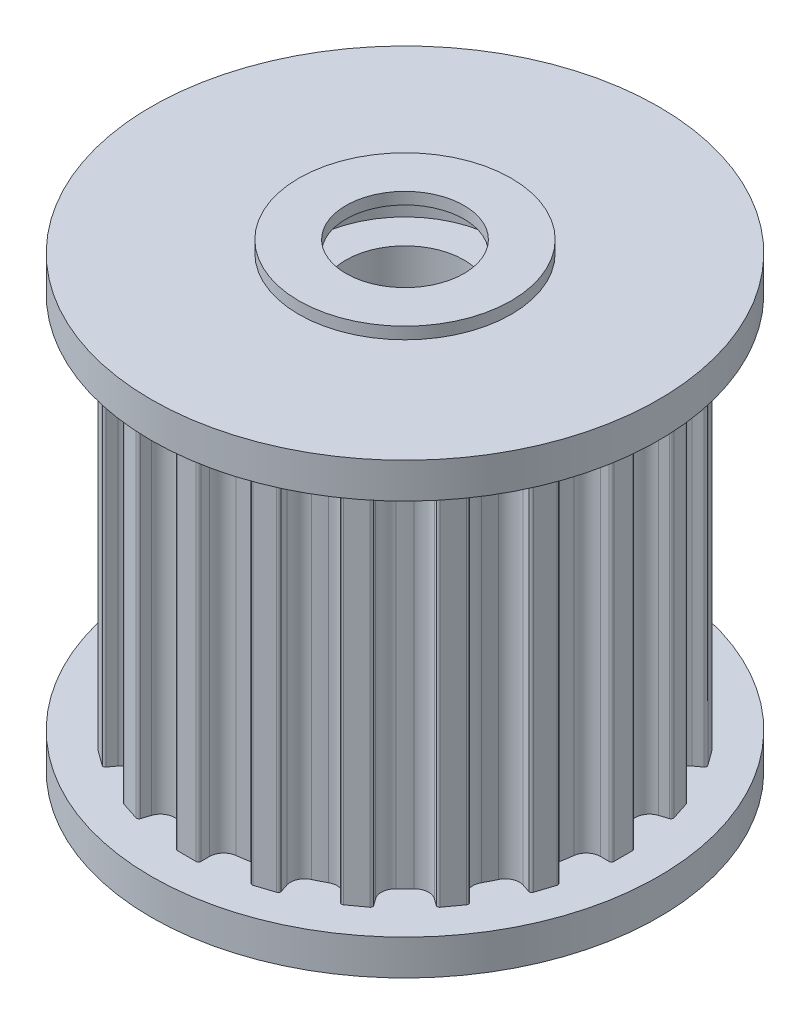
from build123d import *
from build123d.topology import SkipClean

# Parameters (mm, degrees)
SKETCH_1_R                       = 8.25
SKETCH_1_R_2                     = 2.5
EXTRUDE_1_DEPTH                  = 16
SKETCH_2_W                       = 1
SKETCH_2_H                       = 2
EXTRUDE_2_DEPTH                  = 16
FILLET_1_R                       = 0.6
FILLET_2_R                       = 0.1
PATTERN_CIRCULAR_2_COUNT         = 20
FILLET_1_OF_PATTERN_CIRCULAR_2_R = 0.6
FILLET_2_OF_PATTERN_CIRCULAR_2_R = 0.1
EXTRUDE_START                    = 1.5
SKETCH_3_R                       = 10.75
SKETCH_3_R_2                     = 2.5
EXTRUDE_1_2_DEPTH                = 1.5
SKETCH_4_R                       = 10.75
SKETCH_4_R_2                     = 4
EXTRUDE_2_2_DEPTH                = 1.5
EXTRUDE_START_2                  = 0.5
SKETCH_5_R                       = 4.5
SKETCH_5_R_2                     = 2.5
EXTRUDE_3_DEPTH                  = 0.5
SKETCH_6_R                       = 4.5
SKETCH_6_R_2                     = 2.5
EXTRUDE_4_DEPTH                  = 0.5
SKETCH_9_R                       = 1.5
CUT_EXTRUDE_2_DEPTH              = 24.561090807
EXTRUDE_START_3                  = -4
SKETCH_11_R                      = 1.5
EXTRUDE_4_2_DEPTH                = 4
CUT_EXTRUDE_3_DEPTH              = 2
PATTERN_CIRCULAR_3_COUNT         = 2
PATTERN_CIRCULAR_3_ANGLE         = 90
SKETCH_13_R                      = 1.5
EXTRUDE_5_DEPTH                  = 4
CUT_EXTRUDE_4_DEPTH              = 2


with BuildPart() as part:
    # Эскиз1 → Extrude 1 (new body)
    with BuildSketch(Plane(origin=(0, 0, 0), x_dir=(1, 0, 0), z_dir=(0, 1, 0))):
        with Locations(Location((0, 0, 0), (0, 0, 270))):
            Circle(SKETCH_1_R)
        with Locations(Location((0, 0, 0), (0, 0, 270))):
            Circle(SKETCH_1_R_2, mode=Mode.SUBTRACT)
    extrude(amount=EXTRUDE_1_DEPTH)

    # Эскиз2 → Extrude 2 (add)
    with BuildSketch(Plane(origin=(0, 16, 0), x_dir=(1, 0, 0), z_dir=(0, 1, 0))):
        with Locations((0, 8.25)):
            Rectangle(SKETCH_2_W, SKETCH_2_H)
    extrude_2 = extrude(amount=-EXTRUDE_2_DEPTH)

    # Скругление1
    fillet_1_edges = [part.edges().sort_by_distance(p)[0] for p in [
        (-0.5, 8, -8.234834546),
        (0.5, 8, -8.234834546),
    ]]
    fillet(fillet_1_edges, radius=FILLET_1_R)

    # Скругление2
    fillet_2_edges = [part.edges().sort_by_distance(p)[0] for p in [
        (0.5, 8, -9.25),
        (-0.5, 8, -9.25),
    ]]
    fillet(fillet_2_edges, radius=FILLET_2_R)

    # Круговой массив2: Extrude 2 ×20 about axis
    pattern_circular_2_axis = Axis((0, 0, 0), (0, 1, 0))
    for i in range(1, PATTERN_CIRCULAR_2_COUNT):
        add(extrude_2.rotate(pattern_circular_2_axis, i * 360 / PATTERN_CIRCULAR_2_COUNT))

    # Скругление1 of Круговой массив2
    fillet_1_of_pattern_circular_2_edges = [part.edges().sort_by_distance(p)[0] for p in [
        (-3.020232079, 8, -7.677284558),
        (-2.069175562, 8, -7.986301553),
        (-5.244822798, 8, -6.368228467),
        (-4.435805804, 8, -6.95601372),
        (-6.95601372, 8, -4.435805804),
        (-6.368228467, 8, -5.244822798),
        (-7.986301553, 8, -2.069175562),
        (-7.677284558, 8, -3.020232079),
        (-8.234834546, 8, 0.5),
        (-8.234834546, 8, -0.5),
        (-7.677284558, 8, 3.020232079),
        (-7.986301553, 8, 2.069175562),
        (-6.368228467, 8, 5.244822798),
        (-6.95601372, 8, 4.435805804),
        (-4.435805804, 8, 6.95601372),
        (-5.244822798, 8, 6.368228467),
        (-2.069175562, 8, 7.986301553),
        (-3.020232079, 8, 7.677284558),
        (0.5, 8, 8.234834546),
        (-0.5, 8, 8.234834546),
        (3.020232079, 8, 7.677284558),
        (2.069175562, 8, 7.986301553),
        (5.244822798, 8, 6.368228467),
        (4.435805804, 8, 6.95601372),
        (6.95601372, 8, 4.435805804),
        (6.368228467, 8, 5.244822798),
        (7.986301553, 8, 2.069175562),
        (7.677284558, 8, 3.020232079),
        (8.234834546, 8, -0.5),
        (8.234834546, 8, 0.5),
        (7.677284558, 8, -3.020232079),
        (7.986301553, 8, -2.069175562),
        (6.368228467, 8, -5.244822798),
        (6.95601372, 8, -4.435805804),
        (4.435805804, 8, -6.95601372),
        (5.244822798, 8, -6.368228467),
        (2.069175562, 8, -7.986301553),
        (3.020232079, 8, -7.677284558),
    ]]
    fillet(fillet_1_of_pattern_circular_2_edges, radius=FILLET_1_OF_PATTERN_CIRCULAR_2_R)

    # Скругление2 of Круговой массив2
    fillet_2_of_pattern_circular_2_edges = [part.edges().sort_by_distance(p)[0] for p in [
        (-2.38287894, 8, -8.951781273),
        (-3.333935456, 8, -8.642764279),
        (-5.032505087, 8, -7.777299824),
        (-5.841522081, 8, -7.189514572),
        (-7.189514572, 8, -5.841522081),
        (-7.777299824, 8, -5.032505087),
        (-8.642764279, 8, -3.333935456),
        (-8.951781273, 8, -2.38287894),
        (-9.25, 8, -0.5),
        (-9.25, 8, 0.5),
        (-8.951781273, 8, 2.38287894),
        (-8.642764279, 8, 3.333935456),
        (-7.777299824, 8, 5.032505087),
        (-7.189514572, 8, 5.841522081),
        (-5.841522081, 8, 7.189514572),
        (-5.032505087, 8, 7.777299824),
        (-3.333935456, 8, 8.642764279),
        (-2.38287894, 8, 8.951781273),
        (-0.5, 8, 9.25),
        (0.5, 8, 9.25),
        (2.38287894, 8, 8.951781273),
        (3.333935456, 8, 8.642764279),
        (5.032505087, 8, 7.777299824),
        (5.841522081, 8, 7.189514572),
        (7.189514572, 8, 5.841522081),
        (7.777299824, 8, 5.032505087),
        (8.642764279, 8, 3.333935456),
        (8.951781273, 8, 2.38287894),
        (9.25, 8, 0.5),
        (9.25, 8, -0.5),
        (8.951781273, 8, -2.38287894),
        (8.642764279, 8, -3.333935456),
        (7.777299824, 8, -5.032505087),
        (7.189514572, 8, -5.841522081),
        (5.841522081, 8, -7.189514572),
        (5.032505087, 8, -7.777299824),
        (3.333935456, 8, -8.642764279),
        (2.38287894, 8, -8.951781273),
    ]]
    fillet(fillet_2_of_pattern_circular_2_edges, radius=FILLET_2_OF_PATTERN_CIRCULAR_2_R)

    # Эскиз3 → Extrude 1 2 (add)
    with SkipClean():  # the faces are left unmerged after this step: merging them gives an invalid solid
        with BuildSketch(Plane.XZ.offset(EXTRUDE_START)):
            Circle(SKETCH_3_R)
            Circle(SKETCH_3_R_2, mode=Mode.SUBTRACT)
        extrude(amount=-EXTRUDE_1_2_DEPTH)

    # Эскиз4 → Extrude 2 2 (add)
    with BuildSketch(Plane(origin=(0, 16, 0), x_dir=(1, 0, 0), z_dir=(0, 1, 0))):
        Circle(SKETCH_4_R)
        Circle(SKETCH_4_R_2, mode=Mode.SUBTRACT)
    extrude(amount=EXTRUDE_2_2_DEPTH)

    # Эскиз5 → Вытянуть-Тонкостенный3 (add)
    with BuildSketch(Plane.XZ.offset(1.5).offset(EXTRUDE_START_2)):
        Circle(SKETCH_5_R)
        Circle(SKETCH_5_R_2, mode=Mode.SUBTRACT)
    extrude(amount=-EXTRUDE_3_DEPTH)

    # Эскиз6 → Extrude 4 (add)
    with BuildSketch(Plane(origin=(0, 17.5, 0), x_dir=(1, 0, 0), z_dir=(0, 1, 0))):
        Circle(SKETCH_6_R)
        Circle(SKETCH_6_R_2, mode=Mode.SUBTRACT)
    extrude(amount=EXTRUDE_4_DEPTH)

    # Эскиз9 → Вырез-Вытянуть2 (cut, through all)
    with BuildSketch(Plane(origin=(0, 0, 0), x_dir=(0, -1, 0), z_dir=(0.9510565162951534, 0, 0.3090169943749482))):
        with Locations(Location((-8, -1.289904334, 0), (0, 0, 143.610629276))):
            Circle(SKETCH_9_R)
    cut_extrude_2 = extrude(amount=-CUT_EXTRUDE_2_DEPTH, mode=Mode.SUBTRACT)

    # Круговой массив3: Вырез-Вытянуть2 ×2 about axis
    pattern_circular_3_axis = Axis((0, 0, 0), (0, -1, 0))
    for i in range(1, PATTERN_CIRCULAR_3_COUNT):
        add(cut_extrude_2.rotate(pattern_circular_3_axis, i * PATTERN_CIRCULAR_3_ANGLE / (PATTERN_CIRCULAR_3_COUNT - 1)), mode=Mode.SUBTRACT)

    # Эскиз13 → Бобышка-Вытянуть5 (add)
    with BuildSketch(Plane(origin=(0, 0, 0), x_dir=(0, -1, 0), z_dir=(-0.3090169943749482, 0, 0.9510565162951534)).offset(EXTRUDE_START_3)):
        with Locations(Location((-8, -1.289904334, 0), (0, 0, 90))):
            Circle(SKETCH_13_R)
    extrude(amount=-EXTRUDE_5_DEPTH)

    # Эскиз14 → Вырез-Вытянуть4 (cut)
    with BuildSketch(Plane(origin=(2.472135955, 0, -7.60845213), x_dir=(-0.9510565162951533, 0, -0.30901699437494823), z_dir=(0.30901699437494823, 0, -0.9510565162951533))):
        Polygon((1.289904334, 6.845299462), (2.289904334, 7.422649731), (2.289904334, 8.577350269), (1.289904334, 9.154700538), (0.289904334, 8.577350269), (0.289904334, 7.422649731), align=None)
    extrude(amount=-CUT_EXTRUDE_4_DEPTH, mode=Mode.SUBTRACT)


with BuildPart() as body_2:
    # Эскиз11 → Extrude 4 2 (new body)
    with BuildSketch(Plane(origin=(0, 0, 0), x_dir=(0, -1, 0), z_dir=(0.9510565162951534, 0, 0.3090169943749482)).offset(EXTRUDE_START_3)):
        with Locations(Location((-8, -1.289904334, 0), (0, 0, 90))):
            Circle(SKETCH_11_R)
    extrude(amount=-EXTRUDE_4_2_DEPTH)

    # Эскиз12 → Вырез-Вытянуть3 (cut)
    with BuildSketch(Plane(origin=(-7.60845213, 0, -2.472135955), x_dir=(-0.30901699437494823, 0, 0.9510565162951533), z_dir=(-0.9510565162951533, 0, -0.30901699437494823))):
        Polygon((0.135203795, 8), (0.712554065, 7), (1.867254603, 7), (2.444604872, 8), (1.867254603, 9), (0.712554065, 9), align=None)
    extrude(amount=-CUT_EXTRUDE_3_DEPTH, mode=Mode.SUBTRACT)


solid = Compound([part.part, body_2.part])
